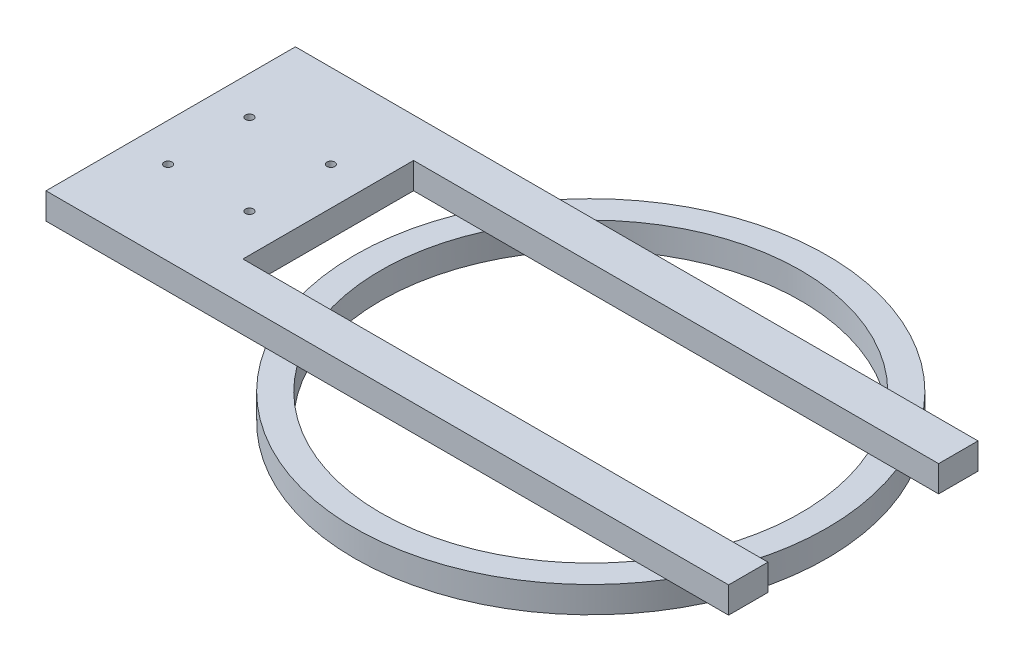
from build123d import *

# Parameters (mm, degrees)
SKETCH1_R           = 90
SKETCH1_R_2         = 80
BOSS_EXTRUDE1_DEPTH = 10
SKETCH2_R           = 2.5
SKETCH3_W           = 200
SKETCH3_H           = 15
BOSS_EXTRUDE2_DEPTH = 10
SKETCH5_W           = 60
SKETCH5_H           = 95
SKETCH5_R           = 1.5
BOSS_EXTRUDE3_DEPTH = 10
SKETCH7_W           = 44.3
SKETCH7_H           = 44.3
SKETCH7_W_2         = 42.3
SKETCH7_H_2         = 42.3
BOSS_EXTRUDE4_DEPTH = 5


with BuildPart() as part:
    # Sketch1 → Boss-Extrude1 (new body)
    with BuildSketch(Plane(origin=(0, 0, 0), x_dir=(1, 0, 0), z_dir=(0, 1, 0))):
        Circle(SKETCH1_R)
        Circle(SKETCH1_R_2, mode=Mode.SUBTRACT)
    extrude(amount=BOSS_EXTRUDE1_DEPTH)

    # Sketch2 → Cut-Revolve1 (revolve, cut)
    with BuildSketch(Plane.XY):
        with Locations((-85, 0)):
            Circle(SKETCH2_R)
    revolve(axis=Axis((0, 0, 0), (0, 1, 0)), mode=Mode.SUBTRACT)

    # Sketch3 → Boss-Extrude2 (add)
    with BuildSketch(Plane(origin=(0, 10, 0), x_dir=(1, 0, 0), z_dir=(0, 1, 0))):
        with Locations((0, -40)):
            Rectangle(SKETCH3_W, SKETCH3_H)
        with Locations((0, 40)):
            Rectangle(SKETCH3_W, SKETCH3_H)
    extrude(amount=BOSS_EXTRUDE2_DEPTH)

    # Sketch5 → Boss-Extrude3 (add)
    with BuildSketch(Plane.XZ.offset(-10)):
        with Locations((-130, 0)):
            Rectangle(SKETCH5_W, SKETCH5_H)
        with Locations((-145.5, -15.5)):
            Circle(SKETCH5_R, mode=Mode.SUBTRACT)
        with Locations((-114.5, -15.5)):
            Circle(SKETCH5_R, mode=Mode.SUBTRACT)
        with Locations((-114.5, 15.5)):
            Circle(SKETCH5_R, mode=Mode.SUBTRACT)
        with Locations((-145.5, 15.5)):
            Circle(SKETCH5_R, mode=Mode.SUBTRACT)
    extrude(amount=-BOSS_EXTRUDE3_DEPTH)

    # Sketch7 → Boss-Extrude4 (add)
    with BuildSketch(Plane.XZ.offset(-10)):
        with Locations((-130, 0)):
            Rectangle(SKETCH7_W, SKETCH7_H)
        with Locations((-130, 0)):
            Rectangle(SKETCH7_W_2, SKETCH7_H_2, mode=Mode.SUBTRACT)
    extrude(amount=BOSS_EXTRUDE4_DEPTH)


solid = part.part
